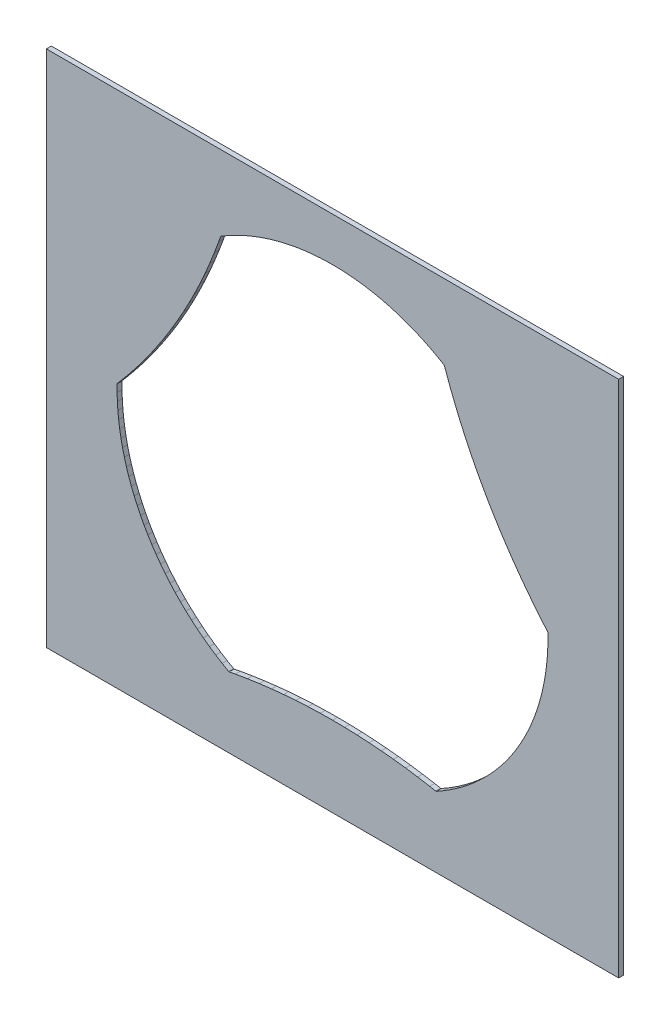
from build123d import *

# Parameters (mm, degrees)
SKETCH2_W           = 115.8494
SKETCH2_H           = 104.9528
BOSS_EXTRUDE1_DEPTH = 1
CUT_EXTRUDE2_DEPTH  = 310.336917135


with BuildPart() as part:
    # Sketch2 → Boss-Extrude1 (new body)
    with BuildSketch(Plane.XY):
        with Locations((123.380390304, -198.156384233)):
            Rectangle(SKETCH2_W, SKETCH2_H)
    extrude(amount=BOSS_EXTRUDE1_DEPTH)

    # Sketch3 → Cut-Extrude2 (cut, through all)
    with BuildSketch(Plane.XY):
        Polygon((80.636137674, -196.195163546), (82.211155605, -194.289585679), (83.74332748, -192.349388588), (85.23189082, -190.375537884), (86.676109641, -188.369012427), (88.075264151, -186.330808737), (89.428661052, -184.261938059), (90.735629126, -182.163427826), (91.995517764, -180.036320192), (93.207702852, -177.881670557), (94.371582353, -175.700547571), (95.486577785, -173.494036075), (96.552137159, -171.263231213), (97.567730567, -169.009238433), (98.532853124, -166.733179375), (99.447026439, -164.436181567), (100.309795675, -162.119387257), (100.715265554, -160.95166739), (100.727163474, -160.932627479), (100.734928107, -160.911566556), (100.748586502, -160.898349752), (100.758665069, -160.882227282), (100.777644629, -160.870236628), (100.793778875, -160.854629347), (102.117724632, -160.084413066), (103.46790381, -159.361168768), (104.842648668, -158.685786993), (106.240266443, -158.059102348), (107.659029043, -157.481887616), (109.097187771, -156.954855229), (110.552968903, -156.478654326), (112.02457664, -156.053873694), (113.5101931, -155.681037354), (115.007988625, -155.36060456), (116.516111481, -155.092971271), (118.032705515, -154.878467209), (119.555895439, -154.717355855), (121.083804494, -154.609838869), (122.614547088, -154.556047257), (124.146233214, -154.556047257), (125.676975808, -154.609838869), (127.204884862, -154.717355855), (128.728074787, -154.878467209), (130.24466882, -155.092971271), (131.752791676, -155.36060456), (133.250587202, -155.681037354), (134.736203662, -156.053873694), (136.207811398, -156.478654326), (137.663592531, -156.954855229), (139.101751259, -157.481887616), (140.520513859, -158.059102348), (141.918131633, -158.685786993), (143.292876492, -159.361168768), (144.64305567, -160.084413066), (145.967001427, -160.854629347), (145.983134201, -160.870236628), (146.002115233, -160.882227282), (146.012192328, -160.898349752), (146.025852193, -160.911566557), (146.033615353, -160.932627481), (146.045502968, -160.951670337), (146.450972747, -162.11939171), (147.313743256, -164.436186094), (148.227916375, -166.733183981), (149.193040208, -169.009243121), (150.208633423, -171.263234516), (151.274192606, -173.494040942), (152.389189321, -175.700552533), (153.553068635, -177.881674147), (154.76525501, -180.036323886), (156.025143466, -182.163431628), (157.332112833, -184.261941973), (158.685509556, -186.330812767), (160.084665363, -188.369016576), (161.528884013, -190.375540686), (163.017448656, -192.349391517), (164.549620365, -194.289587267), (166.124638132, -196.195165269), (166.933179973, -197.130172894), (166.943714849, -197.149992949), (166.958076843, -197.167250308), (166.962682411, -197.185689333), (166.971606955, -197.20247566), (166.972498968, -197.224905514), (166.977949667, -197.246683286), (166.983002935, -198.778362052), (166.93427476, -200.309274221), (166.831799266, -201.837529188), (166.675714684, -203.361243133), (166.466216786, -204.87853488), (166.203560223, -206.387533557), (165.88807177, -207.886377125), (165.520138557, -209.37321679), (165.10021542, -210.846217009), (164.628821966, -212.303561372), (164.106536677, -213.743452606), (163.534007221, -215.164111101), (162.911937196, -216.56378816), (162.241094972, -217.940754218), (161.522309266, -219.293312097), (160.756464731, -220.619792584), (159.944509315, -221.918557379), (159.087442485, -223.188006452), (158.186321113, -224.426573628), (157.24225948, -225.632729533), (156.256418969, -226.804986007), (155.230019841, -227.941897576), (154.164325046, -229.042061454), (153.060650522, -230.104120488), (151.920357842, -231.126763152), (150.744855679, -232.108729442), (149.535590976, -233.048806457), (148.294057784, -233.945835757), (147.02178842, -234.79870895), (145.72035053, -235.606376522), (144.391351505, -236.367840478), (144.369768033, -236.374006554), (144.349893516, -236.384451641), (144.330891876, -236.385116971), (144.312617906, -236.390339216), (144.290495694, -236.386531234), (144.26805848, -236.387318737), (143.054048152, -236.154604954), (140.616259513, -235.743388511), (138.169915795, -235.386587794), (135.716228426, -235.084377968), (133.256417669, -234.836912118), (130.791703785, -234.644309473), (128.323311453, -234.506668654), (125.852463877, -234.424057374), (123.380383335, -234.396515449), (120.908316425, -234.424057374), (118.437468849, -234.506668654), (115.969076517, -234.644309473), (113.504362633, -234.836912118), (111.044551876, -235.084377968), (108.590864507, -235.386587794), (106.144520789, -235.743388511), (103.70673215, -236.154604954), (102.492721822, -236.387317265), (102.470283136, -236.386531234), (102.448162396, -236.390339216), (102.429886436, -236.385116672), (102.410886269, -236.384451343), (102.39101028, -236.374006255), (102.369428279, -236.36784018), (101.040429254, -235.606377695), (99.738991365, -234.798710123), (98.466720529, -233.94583693), (97.225187336, -233.04880763), (96.015924106, -232.108730616), (94.84042047, -231.126764325), (93.70012779, -230.104121661), (92.596453267, -229.042062627), (91.530758472, -227.941898749), (90.504357872, -226.80498718), (89.518518833, -225.632730707), (88.5744572, -224.426574802), (87.673335828, -223.188007625), (86.816268997, -221.918558552), (86.004312109, -220.619792286), (85.238469047, -219.29331327), (84.519681869, -217.940755391), (83.848841116, -216.563789333), (83.226771092, -215.164112275), (82.654240163, -213.743452307), (82.131956346, -212.303562545), (81.66056142, -210.846218182), (81.240638284, -209.373216491), (80.872705071, -207.886378298), (80.557216618, -206.38753473), (80.294560054, -204.878536053), (80.085062156, -203.361242834), (79.928977574, -201.83752889), (79.82650208, -200.309273922), (79.777762264, -198.778362052), (79.782817003, -197.246683286), (79.788267702, -197.224905514), (79.789161187, -197.20247566), (79.798084259, -197.185689333), (79.802700352, -197.167248513), (79.817060875, -197.149991156), (79.827597225, -197.130171102), align=None)
    extrude(amount=CUT_EXTRUDE2_DEPTH, mode=Mode.SUBTRACT)


solid = part.part
